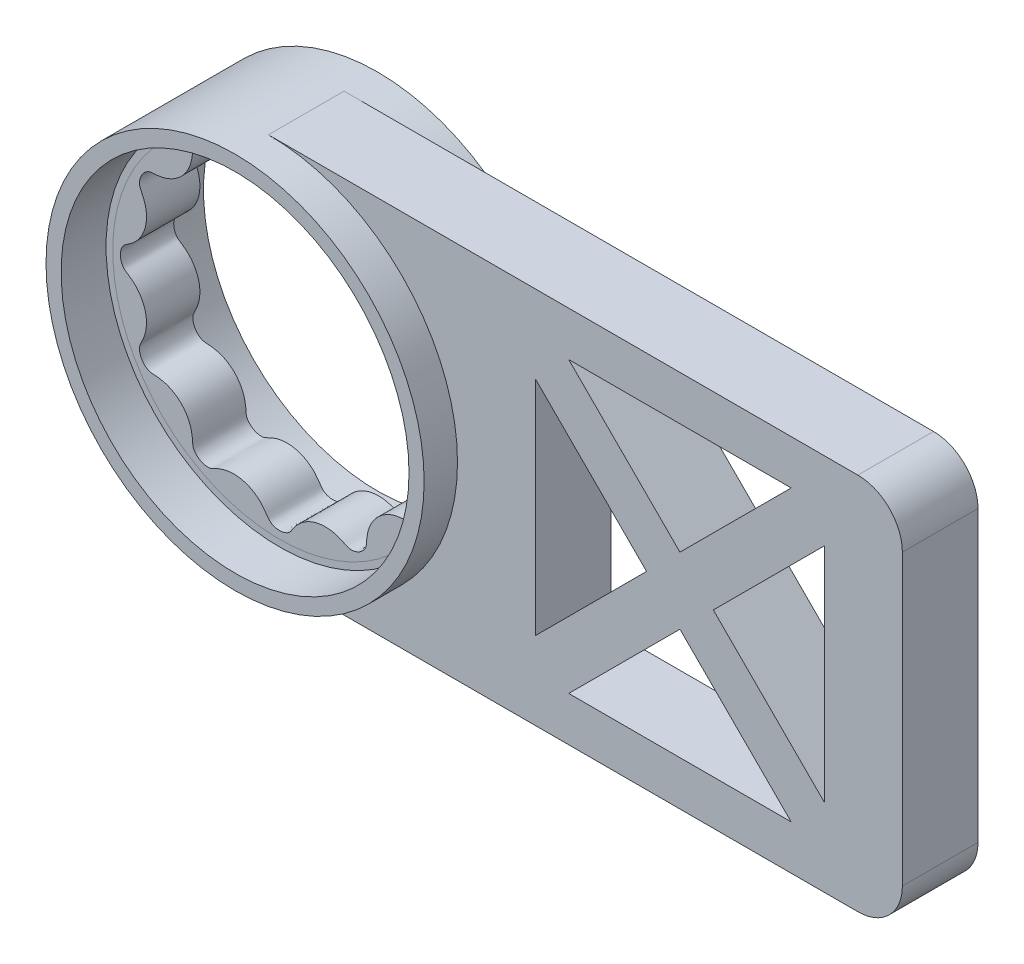
from build123d import *

# Parameters (mm, degrees)
ESQUISSE1_R             = 42.5
ESQUISSE1_R_2           = 39.1
BOSS_EXTRU_2_DEPTH      = 32
ESQUISSE4_R             = 39
ESQUISSE4_R_2           = 37.5
BOSS_EXTRU_4_DEPTH      = 12
ESQUISSE5_R             = 37.5
BOSS_EXTRU_6_DEPTH      = 12
ENL_V_MAT_EXTRU_3_DEPTH = 12
ESQUISSE6_W             = 17
ESQUISSE6_H             = 85
BOSS_EXTRU_7_DEPTH      = 100
BOSS_EXTRU_8_DEPTH      = 14.5
BOSS_EXTRU_8_DEPTH_BACK = 2.5
ENL_V_MAT_EXTRU_4_DEPTH = 52
CONG_1_R                = 10


# Read off the part's stored shape, not the designer's step: Enlèv. mat.-Extru.3
with BuildPart() as part:
    # Esquisse1 → Boss.-Extru.2 (new body)
    with BuildSketch(Plane.XY):
        Circle(ESQUISSE1_R)
        Circle(ESQUISSE1_R_2, mode=Mode.SUBTRACT)
    extrude(amount=BOSS_EXTRU_2_DEPTH)



with BuildPart() as body_2:
    # Esquisse4 → Boss.-Extru.4 (new body)
    with BuildSketch(Plane.XY.offset(10)):
        Circle(ESQUISSE4_R)
        Circle(ESQUISSE4_R_2, mode=Mode.SUBTRACT)
    extrude(amount=BOSS_EXTRU_4_DEPTH)


with BuildPart() as body_3:
    # Esquisse5 → Boss.-Extru.6 (new body)
    with BuildSketch(Plane.XY.offset(10)):
        Circle(ESQUISSE5_R)
    extrude(amount=BOSS_EXTRU_6_DEPTH)

    # Enlèv. mat.-Extru.3 outline → Enlèv. mat.-Extru.3 (cut)
    with BuildSketch(Plane.XY.offset(10)):
        with BuildLine():
            Line((35.789890768, -0.029077947), (35.79, 0))
            add(Edge.make_bspline(
                [(35.79, 0), (35.79, 0.127639257), (35.778773221, 0.332778615), (35.751800956, 0.550165303), (35.708661066, 0.806297374), (35.637092462, 1.089154863), (35.518929188, 1.420366645), (35.377797584, 1.713768291), (35.247271338, 1.925540597), (35.137539018, 2.07532933), (35.057864121, 2.172252362), (34.9697529, 2.268034114), (34.891049162, 2.344192302), (34.801897946, 2.421729875), (34.69946496, 2.501431646), (34.596030594, 2.575439949), (34.500719143, 2.640565416), (34.318289008, 2.760845312), (34.02375405, 2.954451504), (33.701874887, 3.177905887), (33.383346306, 3.408429746), (32.981888377, 3.733470258), (32.531197085, 4.133377044), (31.871067649, 4.796975418), (31.068067937, 5.947587573), (30.472373317, 7.133452491), (30.061603701, 8.481846392), (29.888749816, 9.803379457), (29.914580672, 10.998511079), (30.102609971, 12.237438542), (30.382060144, 13.143621741), (30.636801119, 13.792630936), (30.816186498, 14.187427774), (30.943376886, 14.451879211), (31.0689779, 14.704292097), (31.161104553, 14.887140556), (31.2318527, 15.032338739), (31.278096351, 15.132052587), (31.323132219, 15.235489538), (31.362248496, 15.336628462), (31.398692502, 15.448320134), (31.429003266, 15.562819921), (31.454028522, 15.684822556), (31.479702439, 15.858919885), (31.495635281, 16.099637434), (31.482672589, 16.416961113), (31.433749716, 16.753910576), (31.34708099, 17.100368066), (31.181426931, 17.562942897), (30.943240717, 18.009153182), (30.647260345, 18.409401982), (30.402285687, 18.680583556), (30.14127001, 18.917288139), (29.872471771, 19.11533163), (29.605887647, 19.271728853), (29.393589263, 19.367188973), (29.234529458, 19.423681926), (29.119044093, 19.457587012), (29.003119698, 19.484459665), (28.906210279, 19.501477295), (28.806535958, 19.514652758), (28.714282036, 19.5244974), (28.592052543, 19.534654342), (28.42338179, 19.545849621), (28.172284799, 19.559711481), (27.832755677, 19.582540906), (27.466980271, 19.615253244), (26.929513883, 19.678606682), (26.007949438, 19.859369436), (24.480873664, 20.32540815), (22.133767779, 21.835393957), (20.769553097, 23.717778361), (20.188745435, 25.008264309), (19.863427201, 25.99165496), (19.699659602, 26.804732782), (19.62072513, 27.405174555), (19.586431757, 27.785673237), (19.561270963, 28.142953682), (19.54704536, 28.404004221), (19.535490733, 28.579954578), (19.524972142, 28.70930536), (19.5153958, 28.800535112), (19.502752617, 28.897829516), (19.484875266, 29.001211669), (19.458858121, 29.114046792), (19.425241788, 29.22977198), (19.369024421, 29.389032777), (19.274379562, 29.600724405), (19.11875834, 29.867272371), (18.921506453, 30.136098434), (18.68549984, 30.397370908), (18.414950793, 30.642712051), (18.015371832, 30.939368383), (17.569580645, 31.178417899), (17.107108897, 31.345029218), (16.760554766, 31.432432917), (16.423340885, 31.482075198), (16.10552067, 31.495704603), (15.864311796, 31.480249261), (15.689680439, 31.454878917), (15.567439252, 31.430085323), (15.452573139, 31.399939552), (15.341189665, 31.363875073), (15.240261721, 31.325068493), (15.138894908, 31.281156682), (15.041278656, 31.236131671), (14.900097358, 31.167410075), (14.689678306, 31.062100064), (14.354835126, 30.893629354), (13.865243952, 30.668960177), (13.272972598, 30.428393217), (12.425347818, 30.15426356), (11.326281988, 29.953102301), (9.82258172, 29.849558178), (7.95986682, 30.135810078), (6.293648235, 30.868825703), (4.988230142, 31.703300007), (4.090869453, 32.560781852), (3.527967775, 33.225694405), (3.220050937, 33.641187129), (2.955599108, 34.021355477), (2.775563917, 34.297067147), (2.658750246, 34.473498073), (2.579075117, 34.590483775), (2.499833919, 34.701526095), (2.426476608, 34.796198343), (2.350145031, 34.884566755), (2.267482311, 34.970231929), (2.178034627, 35.052870462), (2.078668721, 35.134895634), (1.930920344, 35.243676206), (1.719281302, 35.374895996), (1.425877786, 35.516393683), (1.100164649, 35.634098935), (0.63289154, 35.75181763), (0.007401252, 35.81466098), (-0.618690388, 35.754165123), (-1.086953523, 35.638110645), (-1.413833808, 35.521429897), (-1.708608833, 35.380734486), (-1.921589084, 35.249899691), (-2.070392386, 35.141317841), (-2.170861559, 35.059121469), (-2.261050712, 34.976483283), (-2.343304938, 34.892068534), (-2.421254458, 34.802491622), (-2.492418477, 34.711457355), (-2.567715082, 34.606717765), (-2.644312458, 34.494894578), (-2.754751516, 34.328819924), (-2.915999601, 34.081599588), (-3.146975811, 33.744763494), (-3.416581941, 33.370331804), (-3.882758231, 32.799274615), (-4.720392282, 31.910394851), (-6.316892237, 30.800843837), (-8.024209241, 30.17283188), (-9.412330545, 29.914545771), (-10.677673335, 29.891721388), (-11.98007126, 30.042533549), (-12.814391996, 30.278561565), (-13.355852179, 30.465819904), (-13.813307943, 30.646708344), (-14.255420974, 30.847002461), (-14.626366422, 31.029030956), (-14.895539037, 31.165105725), (-15.027898274, 31.229975475), (-15.117098477, 31.271526259), (-15.226844092, 31.319562608), (-15.336650035, 31.362189146), (-15.445017017, 31.397732004), (-15.555219431, 31.427227275), (-15.680827522, 31.45329776), (-15.854573681, 31.479259788), (-16.092675439, 31.495510304), (-16.411211703, 31.483226588), (-16.746987126, 31.435092935), (-17.093637231, 31.349123817), (-17.556369229, 31.184378261), (-18.114604594, 30.887875604), (-18.596491022, 30.494229721), (-18.912934407, 30.14655411), (-19.112191918, 29.877249569), (-19.268894828, 29.611333834), (-19.364897726, 29.399157094), (-19.422831966, 29.237286254), (-19.456665107, 29.122612158), (-19.482308097, 29.013490513), (-19.500982775, 28.90854568), (-19.514721442, 28.806692535), (-19.524489857, 28.716275072), (-19.532889269, 28.617578468), (-19.543936891, 28.450532931), (-19.558187597, 28.188953448), (-19.581617308, 27.853371052), (-19.605689052, 27.563389815), (-19.665938994, 27.023408918), (-19.815911629, 26.184793134), (-20.157318959, 25.004337248), (-20.843954437, 23.653848589), (-21.907442667, 22.173569415), (-23.366068199, 20.981254776), (-24.729875334, 20.299797727), (-25.809319409, 19.908550701), (-26.681320067, 19.720412005), (-27.329223187, 19.628680558), (-27.736877407, 19.590346612), (-28.112211774, 19.563014677), (-28.382726945, 19.548308881), (-28.571483796, 19.536082551), (-28.700131212, 19.525824509), (-28.79357287, 19.516211471), (-28.89378403, 19.503380006), (-28.996103178, 19.485881398), (-29.10987875, 19.459951447), (-29.225176726, 19.426706738), (-29.34451178, 19.384879841), (-29.468665803, 19.333436849), (-29.640172161, 19.251114123), (-29.861998465, 19.122204031), (-30.130954944, 18.925694153), (-30.392436134, 18.690413161), (-30.638152972, 18.420492386), (-30.935488982, 18.021575487), (-31.175393775, 17.576220092), (-31.34296248, 17.113849239), (-31.431102317, 16.767207226), (-31.481463681, 16.42971509), (-31.4957654, 16.111462267), (-31.480769426, 15.869602066), (-31.455756173, 15.694752007), (-31.431086617, 15.571759024), (-31.40127822, 15.457172944), (-31.36534065, 15.345320051), (-31.327156613, 15.245460908), (-31.284090449, 15.145446195), (-31.239676797, 15.048766117), (-31.175818718, 14.917264592), (-31.068186275, 14.701173957), (-30.917280913, 14.403594033), (-30.696544325, 13.926689145), (-30.472211568, 13.390878907), (-30.15950348, 12.456530632), (-29.810946142, 10.730225838), (-30.064689862, 7.899926921), (-31.318948675, 5.426682654), (-32.435505386, 4.20878597), (-33.13999565, 3.59521888), (-33.584832875, 3.260315014), (-33.997977, 2.970889914), (-34.26821336, 2.794741742), (-34.465534156, 2.66394032), (-34.583531573, 2.583900852), (-34.697391976, 2.502995303), (-34.790793135, 2.430824615), (-34.882336437, 2.352216562), (-34.966665648, 2.271100102), (-35.049545251, 2.181842203), (-35.131851143, 2.082557104), (-35.240493763, 1.93564611), (-35.372005815, 1.724543039), (-35.513839403, 1.431924113), (-35.632092679, 1.106708259), (-35.750617163, 0.640010532), (-35.814640989, 0.014763145), (-35.755322825, -0.611565711), (-35.640088635, -1.080369209), (-35.523946323, -1.407769949), (-35.383629297, -1.703270447), (-35.253013755, -1.916896218), (-35.144474765, -2.066297321), (-35.062389745, -2.167084178), (-34.979546359, -2.25788197), (-34.895587666, -2.340059563), (-34.806035847, -2.418326934), (-34.716245766, -2.48880254), (-34.613711332, -2.562791766), (-34.505156163, -2.637397458), (-34.344561813, -2.744409737), (-34.110801882, -2.896806323), (-33.787525171, -3.117036587), (-33.441500377, -3.36430582), (-32.904011705, -3.79028071), (-32.210945892, -4.431178925), (-31.446053197, -5.377937961), (-30.607991425, -6.72355325), (-29.997666198, -8.529921388), (-29.878015885, -10.308985872), (-29.991732291, -11.746712679), (-30.285047246, -12.865829628), (-30.568457782, -13.632179159), (-30.775906261, -14.100407706), (-30.896993107, -14.356172467), (-31.040496863, -14.649263588), (-31.155464883, -14.876248427), (-31.227379711, -15.022559806), (-31.268924506, -15.111351799), (-31.317221413, -15.22107021), (-31.359968329, -15.330486891), (-31.396787168, -15.441883798), (-31.426420105, -15.551797401), (-31.452161795, -15.674366858), (-31.478661208, -15.849145458), (-31.495460108, -16.087814858), (-31.48386322, -16.403887088), (-31.436294764, -16.740835121), (-31.351138722, -17.086913053), (-31.18744962, -17.549512126), (-30.891899758, -18.108582824), (-30.499044995, -18.591313694), (-30.151567066, -18.908814845), (-29.882893308, -19.108441371), (-29.6160486, -19.266453889), (-29.403382202, -19.363177977), (-29.243327728, -19.420827789), (-29.127704923, -19.45527329), (-29.013669148, -19.482312531), (-28.913975927, -19.500211053), (-28.81821181, -19.513277667), (-28.731525722, -19.522830618), (-28.61726108, -19.532729401), (-28.449246476, -19.544244963), (-28.226103439, -19.556744808), (-27.923233777, -19.576222455), (-27.603803462, -19.601708126), (-27.112470284, -19.654287113), (-26.353245612, -19.783202192), (-25.049428282, -20.116121167), (-23.240800751, -21.047007284), (-21.86638758, -22.293709959), (-21.004561724, -23.39697238), (-20.430700942, -24.436535974), (-19.970600305, -25.585062525), (-19.743928101, -26.540921335), (-19.633605636, -27.282444585), (-19.596702715, -27.670593696), (-19.56597939, -28.054518992), (-19.548177295, -28.376924724), (-19.53585915, -28.577059258), (-19.527413149, -28.684759033), (-19.517842903, -28.77986412), (-19.504146955, -28.888089073), (-19.485719167, -28.996731103), (-19.461451493, -29.104155066), (-19.428803137, -29.218603234), (-19.386078204, -29.34129708), (-19.335401529, -29.46426633), (-19.254385951, -29.63403255), (-19.125257179, -29.857339816), (-18.929938438, -30.12569522), (-18.695402763, -30.387417906), (-18.425908503, -30.633673038), (-18.027874016, -30.931534818), (-17.58272221, -31.17241214), (-17.120584948, -31.340886757), (-16.774097519, -31.42970182), (-16.43582711, -31.480874051), (-16.11715006, -31.495810118), (-15.876018051, -31.481376548), (-15.699115839, -31.456490866), (-15.574680951, -31.431787824), (-15.462476382, -31.402842673), (-15.353215345, -31.368020382), (-15.248022286, -31.328150648), (-15.144529793, -31.283831825), (-15.05885294, -31.244624081), (-14.944559613, -31.189448915), (-14.730479024, -31.081546938), (-14.39268809, -30.913808211), (-14.026789203, -30.741547305), (-13.478251331, -30.506018228), (-12.636401368, -30.21270078), (-11.34439868, -29.918886727), (-9.726712469, -29.890750251), (-7.89732145, -30.152636069), (-6.192891366, -30.886669183), (-5.020489356, -31.719244854), (-4.229007445, -32.417244004), (-3.670993957, -33.047605471), (-3.298456821, -33.531506611), (-2.999665125, -33.955389597), (-2.801370681, -34.257671145), (-2.674608735, -34.449678253), (-2.588450789, -34.57696342), (-2.527257759, -34.663380221), (-2.478244919, -34.729277989), (-2.420459035, -34.802828997), (-2.35535137, -34.878841754), (-2.274381951, -34.963441835), (-2.185415977, -35.046402131), (-2.086670476, -35.128619532), (-1.940185611, -35.237433417), (-1.729872438, -35.369053471), (-1.437908616, -35.511303448), (-1.113253374, -35.630069187), (-0.647108873, -35.749409029), (-0.0221246, -35.814605679), (0.604438741, -35.756466353), (1.073780012, -35.642055662), (1.401723308, -35.526438449), (1.69787171, -35.386547214), (1.912257647, -35.256072056), (2.062139825, -35.147669966), (2.163362421, -35.065588031), (2.254592115, -34.982722842), (2.336945949, -34.898943617), (2.415330125, -34.809643134), (2.485212785, -34.721005437), (2.558341811, -34.61997875), (2.629455425, -34.516987824), (2.73621838, -34.356764135), (2.879898284, -34.137160518), (3.083041138, -33.836266666), (3.324037627, -33.496879076), (3.699351143, -33.012548829), (4.295935003, -32.347685244), (5.126908897, -31.635867869), (6.337688295, -30.805173616), (8.55713609, -29.910844664), (11.239558685, -29.874045167), (12.711513098, -30.238127255), (13.536702603, -30.529411692), (14.020209079, -30.738802871), (14.346938604, -30.892061691), (14.630542584, -31.031919222), (14.846338792, -31.140712481), (15.003715387, -31.218155106), (15.111319494, -31.268711213), (15.220035367, -31.316779934), (15.323321962, -31.35746268), (15.435444326, -31.394836748), (15.549047614, -31.425725131), (15.670304419, -31.451417544), (15.842878283, -31.4780099), (16.08199517, -31.495352744), (16.397888888, -31.484382679), (16.733984669, -31.437616322), (17.080137297, -31.353157211), (17.5430005, -31.190361087), (18.102353959, -30.896000906), (18.58613264, -30.503858238), (18.904548719, -30.156728254), (19.104963678, -29.888110834), (19.263798358, -29.621136818), (19.361195927, -29.408175269), (19.419299229, -29.24796039), (19.454137734, -29.131949027), (19.481342622, -29.01828544), (19.499430394, -28.918804441), (19.512541131, -28.824149296), (19.522065445, -28.739156102), (19.53192012, -28.627831837), (19.543352907, -28.463363886), (19.555234919, -28.253812672), (19.573385788, -27.962949522), (19.597193966, -27.65784334), (19.641597846, -27.2107822), (19.757903642, -26.485763732), (20.029321844, -25.321758298), (20.833784314, -23.57610941), (21.983967377, -22.171879707), (23.04030912, -21.25025454), (24.135382687, -20.576692291), (25.363351526, -20.037530023), (26.204461883, -19.822415164), (26.775208289, -19.710325621), (27.266147948, -19.636407817), (27.632194529, -19.60002509), (28.012413287, -19.568959244), (28.352469774, -19.549435727), (28.565850432, -19.536599409), (28.679703319, -19.527853508), (28.773373024, -19.518593768), (28.881812855, -19.505109352), (28.990976267, -19.486834057), (29.101676455, -19.462078795), (29.214297523, -19.430176801), (29.334884962, -19.38851294), (29.45945333, -19.337499101), (29.630309593, -19.256374492), (29.851135917, -19.129274163), (30.120703699, -18.93398029), (30.382665482, -18.700084622), (30.628931128, -18.431642709), (30.927726747, -18.033909021), (31.169279014, -17.589536191), (31.338779727, -17.127371255), (31.428442843, -16.780248185), (31.480168402, -16.443005669), (31.495821544, -16.122595979), (31.481855568, -15.880851072), (31.457602737, -15.705831879), (31.432693851, -15.578724269), (31.403613917, -15.465148672), (31.370052443, -15.359020785), (31.330432021, -15.2538121), (31.286453991, -15.150505676), (31.246748875, -15.063312836), (31.195434442, -14.956721442), (31.09452457, -14.755642195), (30.93108509, -14.429644798), (30.761085448, -14.067302993), (30.591139207, -13.683325824), (30.402075094, -13.179640924), (30.207506862, -12.576108784), (29.96671082, -11.612060497), (29.877643627, -10.141078209), (29.999742097, -8.785281944), (30.364440264, -7.424282386), (30.903321567, -6.234330971), (31.527920538, -5.265124222), (32.284631548, -4.357031751), (32.946837531, -3.754984119), (33.470342807, -3.342727527), (33.921937948, -3.022171377), (34.234895171, -2.81625967), (34.438555906, -2.682025262), (34.568833555, -2.594061698), (34.657433551, -2.531567823), (34.724691398, -2.48174456), (34.799098275, -2.423530021), (34.875347179, -2.358510744), (34.960376874, -2.277479282), (35.043074647, -2.189179663), (35.125491293, -2.090637483), (35.23433653, -1.944752201), (35.366100154, -1.73519457), (35.508606815, -1.444066733), (35.628052169, -1.120363453), (35.718921174, -0.765656345), (35.773795988, -0.413688745), (35.788940783, -0.155520074), (35.789890768, -0.029077947)],
                knots=[0.082669376, 0.082669376, 0.082669376, 0.082669376, 0.085929696, 0.087559856, 0.089190017, 0.092450337, 0.095710658, 0.098970978, 0.102231299, 0.103861459, 0.10549162, 0.10712178, 0.10875194, 0.1103821, 0.112012261, 0.112827341, 0.113642421, 0.114457501, 0.115272581, 0.115680121, 0.116087661, 0.116291432, 0.116495202, 0.116902742, 0.117106512, 0.117310282, 0.117514052, 0.117717822, 0.117921592, 0.118125362, 0.118532902, 0.118940442, 0.119347982, 0.119755522, 0.120163062, 0.120978142, 0.121793223, 0.122608303, 0.123423383, 0.125053543, 0.126683703, 0.128313864, 0.129944024, 0.131574184, 0.134834505, 0.138094825, 0.141355146, 0.144615467, 0.147875787, 0.154396428, 0.157656749, 0.160917069, 0.16417739, 0.167437711, 0.170698031, 0.173958352, 0.175588512, 0.177218672, 0.178848833, 0.180478993, 0.181294073, 0.182109153, 0.182924233, 0.183739313, 0.184554394, 0.184961934, 0.185369474, 0.185777014, 0.186184554, 0.186592094, 0.186999634, 0.187407174, 0.187610944, 0.187814714, 0.188222254, 0.188629794, 0.189037334, 0.189444874, 0.190259955, 0.191075035, 0.191890115, 0.192705195, 0.193520275, 0.195150436, 0.196780596, 0.198410756, 0.200040916, 0.203301237, 0.206561558, 0.209821878, 0.213082199, 0.216342519, 0.21960284, 0.226123481, 0.229383802, 0.232644122, 0.235904443, 0.239164763, 0.242425084, 0.244055244, 0.245685404, 0.247315565, 0.248945725, 0.250575885, 0.251390965, 0.252206046, 0.253021126, 0.253836206, 0.254651286, 0.255058826, 0.255466366, 0.255873906, 0.256077676, 0.256281446, 0.256688986, 0.256892756, 0.257096526, 0.257504067, 0.257911607, 0.258319147, 0.258726687, 0.259541767, 0.260356847, 0.261171927, 0.261987007, 0.263617168, 0.265247328, 0.266877488, 0.268507649, 0.270137809, 0.271767969, 0.27502829, 0.27828861, 0.281548931, 0.284809251, 0.291329893, 0.297850534, 0.301110854, 0.304371175, 0.307631495, 0.310891816, 0.312521976, 0.314152137, 0.315782297, 0.317412457, 0.319042617, 0.320672778, 0.321487858, 0.322302938, 0.323118018, 0.323933098, 0.324340638, 0.324748178, 0.325155719, 0.325563259, 0.325970799, 0.326174569, 0.326378339, 0.326582109, 0.326785879, 0.327193419, 0.327397189, 0.327600959, 0.328008499, 0.328823579, 0.329638659, 0.330453739, 0.33126882, 0.3320839, 0.33371406, 0.33534422, 0.336974381, 0.338604541, 0.340234701, 0.343495022, 0.346755342, 0.350015663, 0.353275984, 0.356536304, 0.363056945, 0.369577586, 0.372837907, 0.376098228, 0.379358548, 0.382618869, 0.384249029, 0.385879189, 0.38750935, 0.38913951, 0.38995459, 0.39076967, 0.39158475, 0.39239983, 0.393214911, 0.393622451, 0.394029991, 0.394437531, 0.394845071, 0.395252611, 0.395456381, 0.395660151, 0.396067691, 0.396271461, 0.396475231, 0.396882771, 0.397290311, 0.397697851, 0.398105391, 0.398920472, 0.399735552, 0.400550632, 0.401365712, 0.402180792, 0.403810952, 0.405441113, 0.407071273, 0.408701433, 0.410331594, 0.411961754, 0.415222075, 0.418482395, 0.421742716, 0.425003036, 0.428263357, 0.434783998, 0.438044319, 0.441304639, 0.44456496, 0.44782528, 0.451085601, 0.452715761, 0.454345921, 0.455976082, 0.457606242, 0.459236402, 0.460051482, 0.460866563, 0.461681643, 0.462496723, 0.463311803, 0.463719343, 0.464126883, 0.464534423, 0.464941963, 0.465349503, 0.465757043, 0.466164584, 0.466572124, 0.466979664, 0.467387204, 0.468202284, 0.469017364, 0.469832444, 0.470647524, 0.472277685, 0.473907845, 0.475538005, 0.477168165, 0.478798326, 0.480428486, 0.483688807, 0.486949127, 0.490209448, 0.493469768, 0.49999041, 0.506511051, 0.509771371, 0.513031692, 0.516292012, 0.519552333, 0.521182493, 0.522812654, 0.524442814, 0.526072974, 0.527703134, 0.529333295, 0.530148375, 0.530963455, 0.531778535, 0.532593615, 0.533001155, 0.533408695, 0.533816236, 0.534223776, 0.534427546, 0.534631316, 0.535038856, 0.535242626, 0.535446396, 0.535853936, 0.536261476, 0.536669016, 0.537076556, 0.537484096, 0.538299176, 0.539114256, 0.539929337, 0.540744417, 0.542374577, 0.544004737, 0.545634898, 0.547265058, 0.548895218, 0.552155539, 0.555415859, 0.55867618, 0.561936501, 0.565196821, 0.571717462, 0.578238103, 0.581498424, 0.584758745, 0.588019065, 0.591279386, 0.592909546, 0.594539706, 0.596169867, 0.597800027, 0.598615107, 0.599430187, 0.600245267, 0.601060347, 0.601875428, 0.602282968, 0.602690508, 0.603098048, 0.603505588, 0.603913128, 0.604320668, 0.604524438, 0.604728208, 0.604931978, 0.605135748, 0.605543288, 0.605950828, 0.606358368, 0.606765908, 0.607580989, 0.608396069, 0.609211149, 0.610026229, 0.610841309, 0.612471469, 0.61410163, 0.61573179, 0.61736195, 0.618992111, 0.620622271, 0.623882591, 0.627142912, 0.630403233, 0.633663553, 0.636923874, 0.643444515, 0.646704836, 0.649965156, 0.653225477, 0.656485797, 0.659746118, 0.661376278, 0.663006438, 0.664636599, 0.666266759, 0.667896919, 0.668711999, 0.66952708, 0.67034216, 0.67115724, 0.67197232, 0.67237986, 0.6727874, 0.67319494, 0.67360248, 0.67380625, 0.67401002, 0.67441756, 0.67462133, 0.674825101, 0.675232641, 0.675640181, 0.676047721, 0.676862801, 0.677677881, 0.678492961, 0.679308041, 0.680123121, 0.680938202, 0.682568362, 0.684198522, 0.685828682, 0.687458843, 0.689089003, 0.692349324, 0.695609644, 0.698869965, 0.702130285, 0.708650927, 0.715171568, 0.718431888, 0.721692209, 0.724952529, 0.72821285, 0.72984301, 0.731473171, 0.733103331, 0.734733491, 0.736363651, 0.737993812, 0.738808892, 0.739623972, 0.740439052, 0.741254132, 0.741661672, 0.742069212, 0.742476753, 0.742884293, 0.743088063, 0.743291833, 0.743699373, 0.744106913, 0.744514453, 0.744921993, 0.745329533, 0.745737073, 0.746144613, 0.746959693, 0.747774773, 0.748589854, 0.749404934, 0.751035094, 0.752665254, 0.754295415, 0.755925575, 0.757555735, 0.760816056, 0.764076376, 0.767336697, 0.770597017, 0.773857338, 0.780377979, 0.78689862, 0.790158941, 0.793419262, 0.796679582, 0.799939903, 0.801570063, 0.803200223, 0.804830384, 0.806460544, 0.807275624, 0.808090704, 0.808905784, 0.809720864, 0.810535945, 0.810943485, 0.811351025, 0.811758565, 0.812166105, 0.812573645, 0.812981185, 0.813184955, 0.813388725, 0.813592495, 0.813796265, 0.814203805, 0.814407575, 0.814611345, 0.815018885, 0.815426425, 0.816241506, 0.817056586, 0.817871666, 0.818686746, 0.819501826, 0.821131986, 0.822762147, 0.824392307, 0.826022467, 0.827652628, 0.829282788, 0.832543108, 0.835803429, 0.83906375, 0.84232407, 0.845584391, 0.852105032, 0.855365353, 0.858625673, 0.861885994, 0.865146314, 0.868406635, 0.870036795, 0.871666955, 0.873297116, 0.874927276, 0.876557436, 0.877372516, 0.878187597, 0.879002677, 0.879817757, 0.880632837, 0.881040377, 0.881447917, 0.881651687, 0.881855457, 0.882262997, 0.882466767, 0.882670537, 0.882874307, 0.883078077, 0.883281847, 0.883485617, 0.883893158, 0.884300698, 0.884708238, 0.885523318, 0.886338398, 0.887153478, 0.887968558, 0.888783638, 0.889598719, 0.891228879, 0.892859039, 0.894489199, 0.89611936, 0.89774952, 0.901009841, 0.904270161, 0.907530482, 0.910790802, 0.914051123, 0.917311443, 0.917311443, 0.917311443, 0.917311443], degree=3))
        make_face()
    extrude(amount=ENL_V_MAT_EXTRU_3_DEPTH, mode=Mode.SUBTRACT)


with BuildPart() as body_4:
    # Esquisse6 → Boss.-Extru.7 (new body)
    with BuildSketch(Plane(origin=(42.5, 0, 0), x_dir=(0, 0, -1), z_dir=(1, 0, 0))):
        with Locations((-16, 0)):
            Rectangle(ESQUISSE6_W, ESQUISSE6_H)
    extrude(amount=BOSS_EXTRU_7_DEPTH)


with BuildPart() as part_1:
    add(part.part)

    add(body_4.part)  # Boss.-Extru.8 merges body 4
    # Esquisse10 → Boss.-Extru.8 (add, two sides: drawn at the far end of the back side and taken through both)
    with BuildSketch(Plane.XY.offset(10).offset(-BOSS_EXTRU_8_DEPTH_BACK)):
        with BuildLine():
            Line((0, 39.1), (0, 42.5))
            Line((0, 42.5), (42.5, 42.5))
            Line((42.5, 42.5), (42.5, -42.5))
            Line((42.5, -42.5), (0, -42.5))
            Line((0, -42.5), (0, -39.1))
            ThreePointArc((0, -39.1), (39.1, 0), (0, 39.1))
        make_face()
    extrude(amount=BOSS_EXTRU_8_DEPTH + BOSS_EXTRU_8_DEPTH_BACK)

    # Esquisse11 → Enlèv. mat.-Extru.4 (cut)
    with BuildSketch(Plane.XY.offset(24.5)):
        Polygon((67.5, 32.5), (92.5, 7.5), (117.5, 32.5), align=None)
        Polygon((125, 25), (125, -25), (100, 0), align=None)
        Polygon((117.5, -32.5), (67.5, -32.5), (92.5, -7.5), align=None)
        Polygon((60, -25), (60, 25), (85, 0), align=None)
    extrude(amount=-ENL_V_MAT_EXTRU_4_DEPTH, mode=Mode.SUBTRACT)

    # Congé1
    cong_1_edges = [part_1.edges().sort_by_distance(p)[0] for p in [
        (142.5, -42.5, 16),
        (142.5, 42.5, 16),
    ]]
    fillet(cong_1_edges, radius=CONG_1_R)


solid = Compound([body_2.part, body_3.part, part_1.part])
